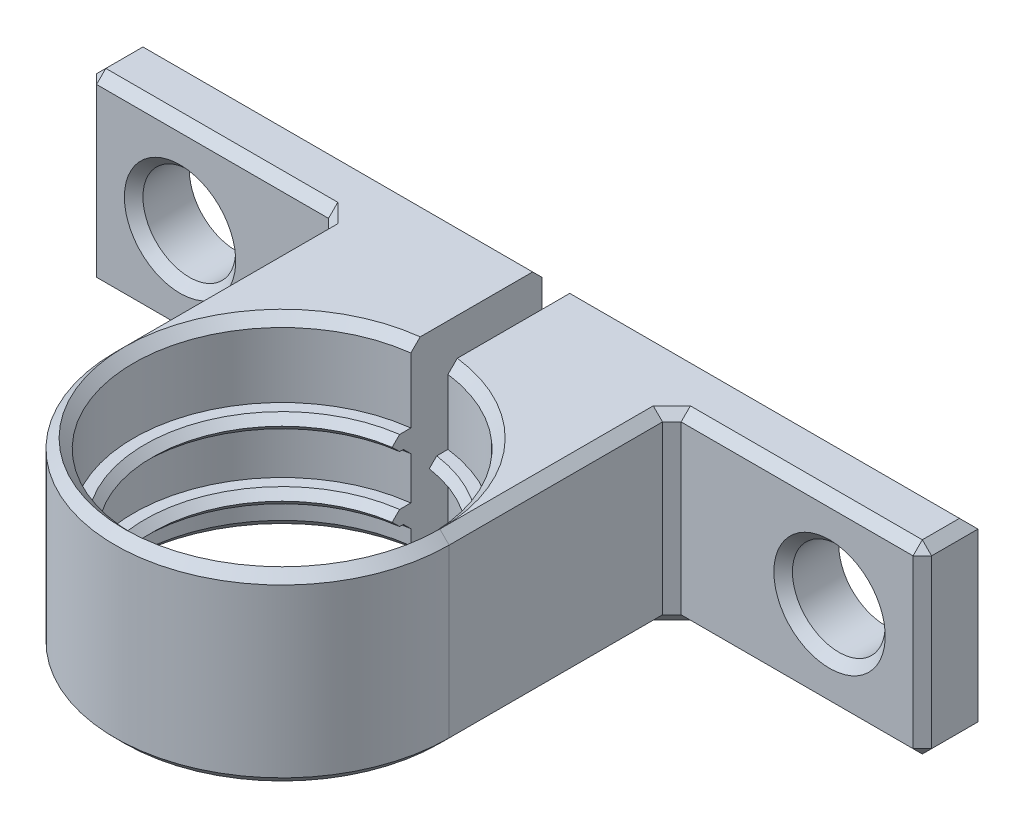
from build123d import *

# Parameters (mm, degrees)
CROQUIS1_R              = 8
SALIENTE_EXTRUIR1_DEPTH = 10
CROQUIS2_R              = 2.5
CORTAR_EXTRUIR2_DEPTH   = 10
SALIENTE_EXTRUIR2_START = -4.8
CROQUIS3_R              = 8
CROQUIS3_R_2            = 7
SALIENTE_EXTRUIR2_DEPTH = 0.8
MATRIZL1_COUNT          = 2
MATRIZL1_PITCH          = 3.5
CHAFL_N1_SIZE           = 0.4
CHAFL_N2_SIZE           = 0.4
CHAFL_N3_SIZE           = 0.5
CROQUIS4_W              = 2
CROQUIS4_H              = 15
CORTAR_EXTRUIR3_DEPTH   = 29.831406487


with BuildPart() as part:
    # Croquis1 → Saliente-Extruir1 (new body)
    with BuildSketch(Plane(origin=(0, 0, 0), x_dir=(1, 0, 0), z_dir=(0, 1, 0))):
        with BuildLine():
            Line((-9, 0), (-9, 12))
            Line((-9, 12), (-22.5, 12))
            Line((-22.5, 12), (-22.5, 15))
            Line((-22.5, 15), (22.5, 15))
            Line((22.5, 15), (22.5, 12))
            Line((22.5, 12), (9, 12))
            Line((9, 12), (9, 0))
            ThreePointArc((9, 0), (0, -9), (-9, 0))
        make_face()
        with Locations(Location((0, 0, 0), (0, 0, 270))):
            Circle(CROQUIS1_R, mode=Mode.SUBTRACT)
    extrude(amount=SALIENTE_EXTRUIR1_DEPTH)

    # Croquis2 → Cortar-Extruir2 (cut)
    with BuildSketch(Plane(origin=(0, 0, -15), x_dir=(-1, 0, 0), z_dir=(0, 0, -1))):
        with Locations((-17.5, 5)):
            Circle(CROQUIS2_R)
        with Locations((17.5, 5)):
            Circle(CROQUIS2_R)
    extrude(amount=-CORTAR_EXTRUIR2_DEPTH, mode=Mode.SUBTRACT)

    # Croquis3 → Saliente-Extruir2 (add)
    with BuildSketch(Plane(origin=(0, 10, 0), x_dir=(1, 0, 0), z_dir=(0, 1, 0)).offset(SALIENTE_EXTRUIR2_START)):
        with Locations(Location((0, 0, 0), (0, 0, 270))):
            Circle(CROQUIS3_R)
        with Locations(Location((0, 0, 0), (0, 0, 270))):
            Circle(CROQUIS3_R_2, mode=Mode.SUBTRACT)
    saliente_extruir2 = extrude(amount=SALIENTE_EXTRUIR2_DEPTH)

    # MatrizL1: Saliente-Extruir2 ×2
    with Locations(*[(0, -i * MATRIZL1_PITCH, 0) for i in range(1, MATRIZL1_COUNT)]):
        add(saliente_extruir2)

    # Chaflán1
    chafl_n1_edges = [part.edges().sort_by_distance(p)[0] for p in [
        (0, 5.2, -7),
        (0, 6, -7),
        (0, 1.7, -7),
        (0, 2.5, -7),
    ]]
    chamfer(chafl_n1_edges, length=CHAFL_N1_SIZE - 0.0001)  # a hair under: the kernel refuses the full size

    # Chaflán2
    chafl_n2_edges = [part.edges().sort_by_distance(p)[0] for p in [
        (0, 5.2, -8),
        (0, 1.7, -8),
    ]]
    chamfer(chafl_n2_edges, length=CHAFL_N2_SIZE)

    # Chaflán3
    chafl_n3_edges = [part.edges().sort_by_distance(p)[0] for p in [
        (22.5, 0, -13.5),
        (15.75, 0, -12),
        (9, 0, -6),
        (0, 0, 9),
        (15.75, 10, -12),
        (-9, 5, -12),
        (-22.5, 5, -12),
        (22.5, 5, -12),
        (9, 5, -12),
        (22.5, 10, -13.5),
        (0, 10, -15),
        (0, 0, -8),
        (0, 10, -8),
        (-22.5, 10, -13.5),
        (-15.75, 10, -12),
        (20, 5, -12),
        (-9, 10, -6),
        (-15, 5, -12),
        (0, 10, 9),
        (-9, 0, -6),
        (9, 10, -6),
        (-15.75, 0, -12),
        (-22.5, 0, -13.5),
        (0, 0, -15),
    ]]
    chamfer(chafl_n3_edges, length=CHAFL_N3_SIZE - 0.0001)  # a hair under: the kernel refuses the full size

    # Croquis4 → Cortar-Extruir3 (cut, through all)
    with BuildSketch(Plane(origin=(0, 10, 0), x_dir=(1, 0, 0), z_dir=(0, 1, 0))):
        with Locations((0, 7.5)):
            Rectangle(CROQUIS4_W, CROQUIS4_H)
    extrude(amount=-CORTAR_EXTRUIR3_DEPTH, mode=Mode.SUBTRACT)


solid = part.part
